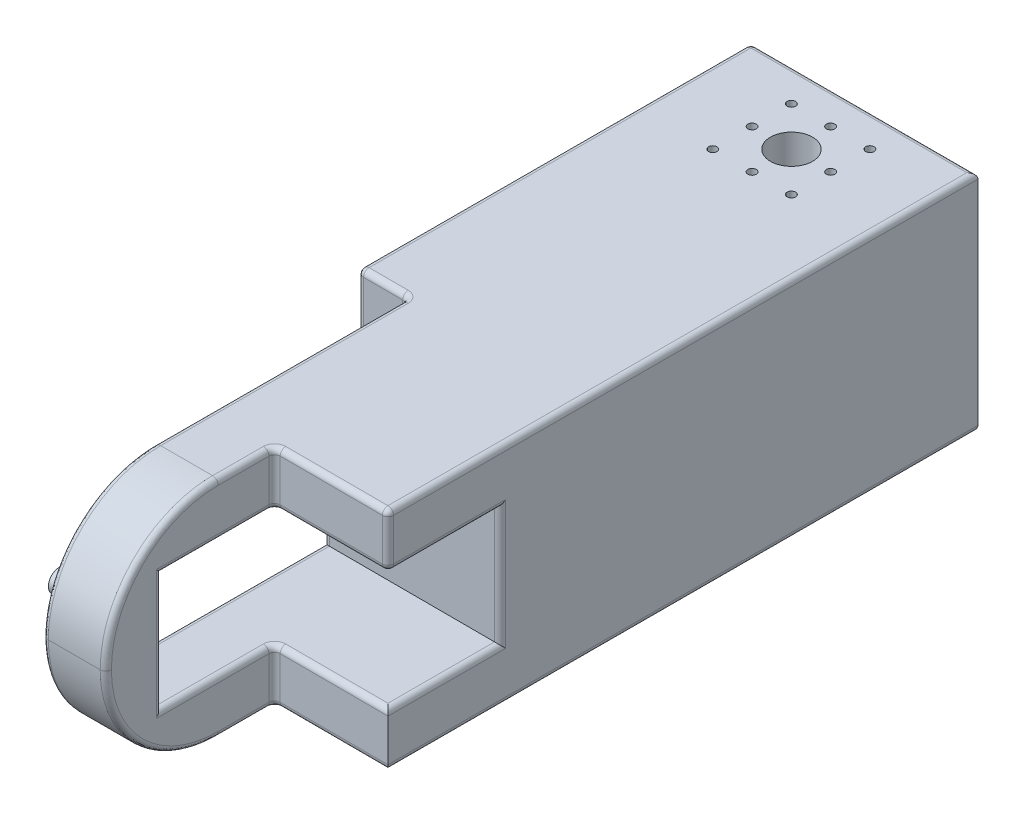
from build123d import *

# Parameters (mm, degrees)
MBODY_DEPTH        = 40
SKETCH5_R          = 0.75
FRONTSCREWS_DEPTH  = 3
SKETCH7_R          = 2.75
GUIDEHOLE_DEPTH    = 4
SERVOCUT_DEPTH     = 40.5
ROUNDEDGE_R        = 20
SKETCH21_W         = 40
SKETCH21_H         = 21
TOPPUSHDOWN_DEPTH  = 9
SKETCH12_R         = 2
SERVOHOLDERS_DEPTH = 2.25
SKETCH14_W         = 35
SKETCH14_H         = 40
CABLEACCESS_DEPTH  = 20.25
ROUNDEDGES_R       = 1
SKETCH8_R          = 0.75
SIDESCREWS1_DEPTH  = 3
SIDESCREWS2_START  = 3
SKETCH17_R         = 0.75
SIDESCREWS2_DEPTH  = 3
SKETCH18_R         = 3.75
CUT_EXTRUDE2_DEPTH = 40
SKETCH22_R         = 0.75
CUT_EXTRUDE4_DEPTH = 3.25


with BuildPart() as part:
    # Sketch4 → MBODY (new body)
    with BuildSketch(Plane(origin=(0, 0, 0), x_dir=(1, 0, 0), z_dir=(0, 1, 0))):
        Polygon((-5, 20), (-25.25, 20), (-25.5, -115), (-5.25, -115), (15, -115), (15.25, 20), align=None)
    extrude(amount=MBODY_DEPTH)

    # Sketch5 → FrontScrews (cut)
    with BuildSketch(Plane(origin=(0, 0, -20), x_dir=(-1, 0, 0), z_dir=(0, 0, -1))):
        with Locations((20, 15)):
            Circle(SKETCH5_R)
        with Locations((20, 25)):
            Circle(SKETCH5_R)
        with Locations((10, 25)):
            Circle(SKETCH5_R)
        with Locations((10, 15)):
            Circle(SKETCH5_R)
        with Locations((0, 15)):
            Circle(SKETCH5_R)
        with Locations((0, 25)):
            Circle(SKETCH5_R)
        with Locations((-10, 25)):
            Circle(SKETCH5_R)
        with Locations((-10, 15)):
            Circle(SKETCH5_R)
    extrude(amount=-FRONTSCREWS_DEPTH, mode=Mode.SUBTRACT)

    # Sketch7 → GuideHole (add)
    with BuildSketch(Plane(origin=(0, 0, -20), x_dir=(-1, 0, 0), z_dir=(0, 0, -1))):
        with Locations((5, 20)):
            Circle(SKETCH7_R)
    extrude(amount=GUIDEHOLE_DEPTH)

    # Sketch10 → ServoCut (cut)
    with BuildSketch(Plane(origin=(-25.286971816, 0, -0.035219388), x_dir=(0.0018518486765310312, 0, -0.9999982853267696), z_dir=(0.9999982853267696, 0, 0.0018518486765310312))):
        Polygon((-105, 20), (-105, 30.5), (-65, 30.5), (-65, 9.5), (-105, 9.5), align=None)
    extrude(amount=SERVOCUT_DEPTH, mode=Mode.SUBTRACT)

    # RoundEdge
    roundedge_edges = [part.edges().sort_by_distance(p)[0] for p in [
        (-5.25, 0, 115),
        (-5.25, 40, 115),
    ]]
    fillet(roundedge_edges, radius=ROUNDEDGE_R - 0.0001)  # a hair under: the kernel refuses the full size

    # Sketch21 → TOPPUSHDOWN (cut)
    # profile 1 of 3: a face of its own
    with BuildSketch(Plane(origin=(-20.212967313, 0, -2739.997650898), x_dir=(0.0018518486765310312, 0, -0.9999982853267696), z_dir=(0.9999982853267696, 0, 0.0018518486765310312))):
        with BuildLine():
            Line((-2835.002512001, 40), (-2889.927314941, 40))
            Line((-2889.927314941, 40), (-2889.927314941, 0))
            Line((-2889.927314941, 0), (-2835.002512001, 0))
            add(Edge.make_bspline(
                [(-2855.002546294, 20), (-2855.002546294, 0), (-2835.002512001, 0)],
                knots=[3.141592654, 3.141592654, 3.141592654, 4.71238898, 4.71238898, 4.71238898], degree=2, weights=[1, 0.707106781, 1]))
            add(Edge.make_bspline(
                [(-2835.002512001, 40), (-2855.002546294, 40), (-2855.002546294, 20)],
                knots=[4.71238898, 4.71238898, 4.71238898, 6.283185307, 6.283185307, 6.283185307], degree=2, weights=[1, 0.707106781, 1]))
        make_face()
    # profile 2 of 3: a face of its own
    with BuildSketch(Plane(origin=(-20.212967313, 0, -2739.997650898), x_dir=(0.0018518486765310312, 0, -0.9999982853267696), z_dir=(0.9999982853267696, 0, 0.0018518486765310312))):
        with BuildLine():
            Line((-2789.927314941, 40), (-2835.002512001, 40))
            add(Edge.make_bspline(
                [(-2835.002512001, 40), (-2855.002546294, 40), (-2855.002546294, 20)],
                knots=[4.71238898, 4.71238898, 4.71238898, 6.283185307, 6.283185307, 6.283185307], degree=2, weights=[1, 0.707106781, 1]))
            add(Edge.make_bspline(
                [(-2855.002546294, 20), (-2855.002546294, 0), (-2835.002512001, 0)],
                knots=[3.141592654, 3.141592654, 3.141592654, 4.71238898, 4.71238898, 4.71238898], degree=2, weights=[1, 0.707106781, 1]))
            Line((-2835.002512001, 0), (-2789.927314941, 0))
            Line((-2789.927314941, 0), (-2789.927314941, 40))
        make_face()
        with Locations((-2824.967129658, 20)):
            Rectangle(SKETCH21_W, SKETCH21_H, mode=Mode.SUBTRACT)
    # profile 3 of 3: a face of its own
    with BuildSketch(Plane(origin=(-20.212967313, 0, -2739.997650898), x_dir=(0.0018518486765310312, 0, -0.9999982853267696), z_dir=(0.9999982853267696, 0, 0.0018518486765310312))):
        with Locations((-2824.967129658, 20)):
            Rectangle(SKETCH21_W, SKETCH21_H)
    extrude(amount=TOPPUSHDOWN_DEPTH, mode=Mode.SUBTRACT)

    # Sketch12 → SERVOHOLDERS (add)
    with BuildSketch(Plane(origin=(-16.287020684, 0, -0.000497241), x_dir=(0.0018518486765310388, 0, -0.9999982853267696), z_dir=(0.9999982853267696, 0, 0.0018518486765310388))):
        with Locations((-109.75, 25)):
            Circle(SKETCH12_R)
        with Locations((-109.75, 15)):
            Circle(SKETCH12_R)
        with Locations((-60.25, 15)):
            Circle(SKETCH12_R)
        with Locations((-60.25, 25)):
            Circle(SKETCH12_R)
    extrude(amount=-SERVOHOLDERS_DEPTH)

    # Sketch14 → CABLEACCESS (cut)
    with BuildSketch(Plane(origin=(15.21295874, 0, 0.002280515), x_dir=(-0.0018518486765310312, 0, 0.9999982853267696), z_dir=(-0.9999982853267696, 0, -0.0018518486765310312))):
        with Locations((102.5, 20)):
            Rectangle(SKETCH14_W, SKETCH14_H)
    extrude(amount=CABLEACCESS_DEPTH, mode=Mode.SUBTRACT)

    # ROUNDEDGES
    roundedges_edges = [part.edges().sort_by_distance(p)[0] for p in [
        (-5.203705773, 0, 89.982367416),
        (-5.203705773, 40, 89.982367416),
        (-5.212966884, 9.5, 94.983367605),
        (-5.212966884, 30.5, 94.983367605),
        (-5.231520093, 20, 105.002100378),
        (-5.239186868, 5.857829025, 109.142158851),
        (-5.239186868, 34.142170975, 109.142158851),
        (-5, 40, -20),
        (-5, 0, -20),
        (4.930568963, 9.5, 84.9833848),
        (4.930568963, 40, 84.9833848),
        (4.930568963, 30.5, 84.9833848),
        (4.930568963, 0, 84.9833848),
        (-5.194413676, 4.75, 84.964634832),
        (-5.194413676, 35.25, 84.964634832),
        (15.152775801, 40, 32.501067384),
        (15.055551602, 35.25, 85.002134768),
        (15.074035367, 30.5, 75.020901835),
        (15.092519132, 20, 65.039668901),
        (15.074035367, 9.5, 75.020901835),
        (15.152775801, 0, 32.501067384),
        (-16.489136714, 34.142170975, 109.142158851),
        (-16.489136714, 5.857829025, 109.142158851),
        (-16.421226834, 0, 72.470823434),
        (-20.879498235, 40, 49.933213549),
        (-20.879498235, 0, 49.933213549),
        (-25.379490519, 20, 49.92488023),
        (-16.379505951, 20, 49.941546868),
        (-16.421226834, 40, 72.470823434),
        (-25.25, 20, -20),
        (-25.314745259, 40, 14.962440115),
        (-25.314745259, 0, 14.962440115),
        (-16.481431359, 20, 104.981267209),
        (-16.444394386, 9.5, 84.981301503),
        (-16.407357412, 20, 64.981335796),
        (-16.444394386, 30.5, 84.981301503),
    ]]
    fillet(roundedges_edges, radius=ROUNDEDGES_R)

    # Sketch8 → SideScrews1 (cut)
    with BuildSketch(Plane(origin=(-15, 0, 0), x_dir=(0, 0, -1), z_dir=(0, 1, 0))):
        with Locations(Location((14, -2.975925926, 0), (0, 0, 180))):
            Circle(SKETCH8_R)
        with Locations(Location((14, -9.975925926, 0), (0, 0, 180))):
            Circle(SKETCH8_R)
        with Locations(Location((7, -2.975925926, 0), (0, 0, 180))):
            Circle(SKETCH8_R)
        with Locations(Location((14, -16.975925926, 0), (0, 0, 180))):
            Circle(SKETCH8_R)
        with Locations(Location((0, -2.975925926, 0), (0, 0, 180))):
            Circle(SKETCH8_R)
        with Locations(Location((7, -16.975925926, 0), (0, 0, 180))):
            Circle(SKETCH8_R)
        with Locations(Location((0, -9.975925926, 0), (0, 0, 180))):
            Circle(SKETCH8_R)
        with Locations(Location((0, -16.975925926, 0), (0, 0, 180))):
            Circle(SKETCH8_R)
    extrude(amount=SIDESCREWS1_DEPTH, mode=Mode.SUBTRACT)

    # Sketch17 → SideScrews2 (cut)
    with BuildSketch(Plane(origin=(30, 40, 0), x_dir=(-1, 0, 0), z_dir=(0, -1, 0)).offset(SIDESCREWS2_START)):
        with Locations(Location((28.024074074, 14, 0), (0, 0, 270))):
            Circle(SKETCH17_R)
        with Locations(Location((35.024074074, 14, 0), (0, 0, 270))):
            Circle(SKETCH17_R)
        with Locations(Location((42.024074074, 14, 0), (0, 0, 270))):
            Circle(SKETCH17_R)
        with Locations(Location((42.024074074, 7, 0), (0, 0, 270))):
            Circle(SKETCH17_R)
        with Locations(Location((28.024074074, 7, 0), (0, 0, 270))):
            Circle(SKETCH17_R)
        with Locations(Location((28.024074074, -0.00489205, 0), (0, 0, 90))):
            Circle(SKETCH17_R)
        with Locations(Location((35.024074074, -0.00489205, 0), (0, 0, 90))):
            Circle(SKETCH17_R)
        with Locations(Location((42.024074074, -0.00489205, 0), (0, 0, 90))):
            Circle(SKETCH17_R)
    extrude(amount=-SIDESCREWS2_DEPTH, mode=Mode.SUBTRACT)

    # Sketch18 → Cut-Extrude2 (cut)
    with BuildSketch(Plane(origin=(30, 0, 0), x_dir=(-1, 0, 0), z_dir=(0, 1, 0))):
        with Locations(Location((35, -7, 0), (0, 0, 90))):
            Circle(SKETCH18_R)
    extrude(amount=CUT_EXTRUDE2_DEPTH, mode=Mode.SUBTRACT)

    # Sketch22 → Cut-Extrude4 (cut)
    with BuildSketch(Plane(origin=(-18.536961893, 0, -0.034327707), x_dir=(-0.001851848676531039, 0, 0.9999982853267696), z_dir=(-0.9999982853267696, 0, -0.001851848676531039))):
        with Locations((60.279663858, 25)):
            Circle(SKETCH22_R)
        with Locations((60.279663858, 15)):
            Circle(SKETCH22_R)
        with Locations((109.779663858, 25)):
            Circle(SKETCH22_R)
        with Locations((109.779663858, 15)):
            Circle(SKETCH22_R)
    extrude(amount=-CUT_EXTRUDE4_DEPTH, mode=Mode.SUBTRACT)


solid = part.part
